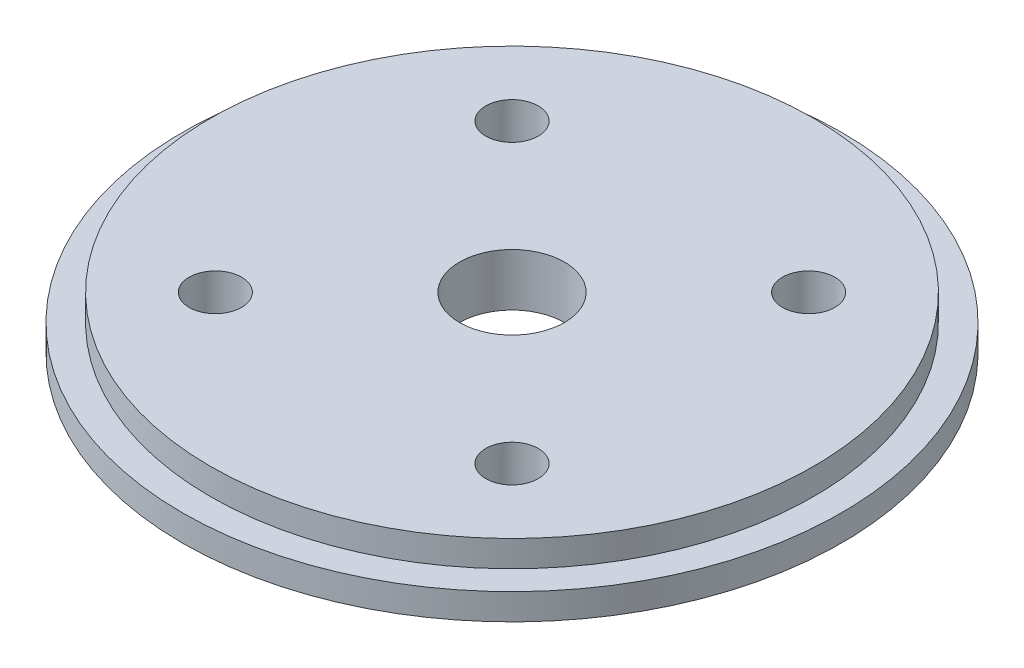
from build123d import *

# Parameters (mm, degrees)
SKETCH2_R                   = 39.9034
BOSS_EXTRUDE1_DEPTH         = 6.35
CUT_EXTRUDE1_START          = -3.175
SKETCH4_R                   = 39.9034
SKETCH4_R_2                 = 36.5125
CUT_EXTRUDE1_DEPTH          = 3.175
F_1_4_0_25_DIAMETER_HOLE1_D = 6.35
F_1_2_0_5_DIAMETER_HOLE1_D  = 12.7
SKETCH9_R                   = 6.35
CUT_EXTRUDE2_DEPTH          = 1.5875


with BuildPart() as part:
    # Sketch2 → Boss-Extrude1 (new body)
    with BuildSketch(Plane(origin=(0, 0, 0), x_dir=(1, 0, 0), z_dir=(0, 1, 0))):
        Circle(SKETCH2_R)
    extrude(amount=BOSS_EXTRUDE1_DEPTH)

    # Sketch4 → Cut-Extrude1 (cut)
    with BuildSketch(Plane(origin=(0, 6.35, 0), x_dir=(1, 0, 0), z_dir=(0, 1, 0)).offset(CUT_EXTRUDE1_START)):
        Circle(SKETCH4_R)
        Circle(SKETCH4_R_2, mode=Mode.SUBTRACT)
    extrude(amount=CUT_EXTRUDE1_DEPTH, mode=Mode.SUBTRACT)

    # 1/4 (0.25) Diameter Hole1 (through all)
    with Locations(Plane(origin=(0, 6.35, 0), x_dir=(1, 0, 0), z_dir=(0, 1, 0))):
        with Locations((-17.960512242, 17.960512242), (-17.960512242, -17.960512242), (17.960512242, 17.960512242), (17.960512242, -17.960512242)):
            Hole(F_1_4_0_25_DIAMETER_HOLE1_D / 2)

    # 1/2 (0.5) Diameter Hole1 (through all)
    with Locations(Plane(origin=(0, 6.35, 0), x_dir=(1, 0, 0), z_dir=(0, 1, 0))):
        with Locations((0, 0)):
            Hole(F_1_2_0_5_DIAMETER_HOLE1_D / 2)

    # Sketch9 → Cut-Extrude2 (cut)
    with BuildSketch(Plane.XZ):
        with Locations((-17.960512242, 17.960512242)):
            Circle(SKETCH9_R)
        with Locations((17.960512242, 17.960512242)):
            Circle(SKETCH9_R)
        with Locations((17.960512242, -17.960512242)):
            Circle(SKETCH9_R)
        with Locations((-17.960512242, -17.960512242)):
            Circle(SKETCH9_R)
    extrude(amount=-CUT_EXTRUDE2_DEPTH, mode=Mode.SUBTRACT)


solid = part.part
